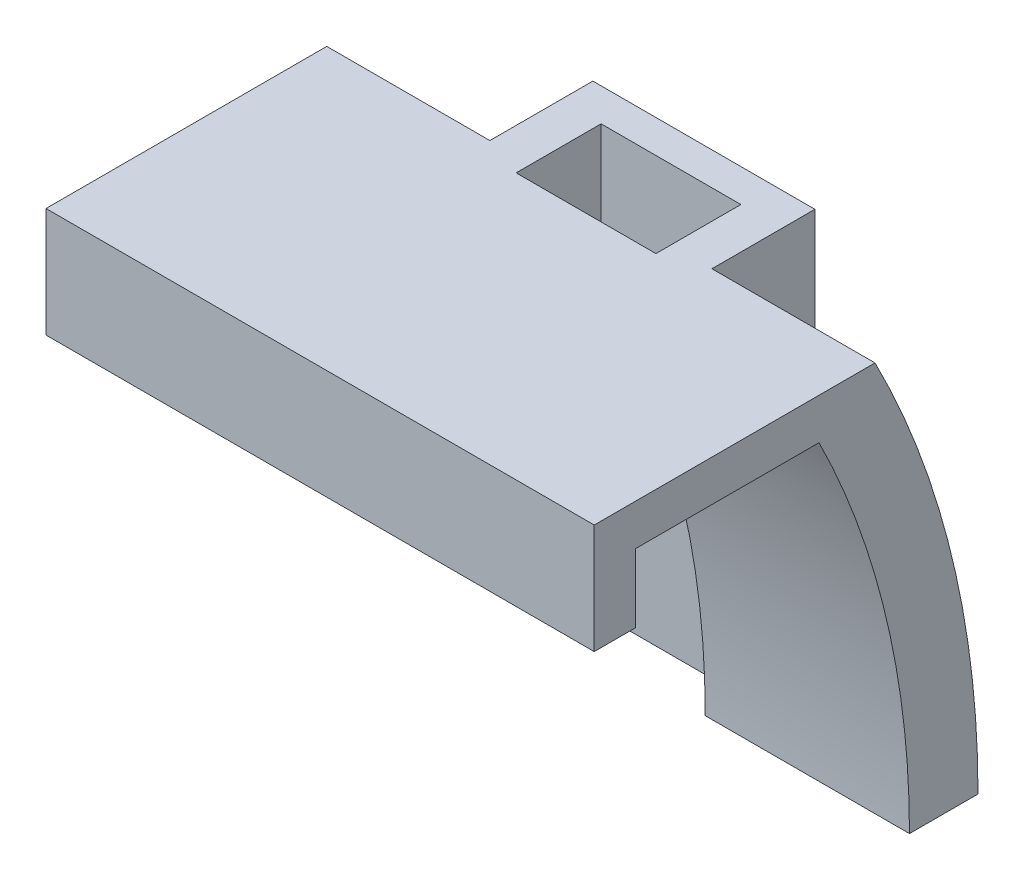
from build123d import *

# Parameters (mm, degrees)
BOSS_EXTRUDE1_DEPTH = 25.4
BOSS_EXTRUDE2_DEPTH = 10.287
SKETCH4_W           = 12.954
SKETCH4_H           = 7.874
CUT_EXTRUDE1_DEPTH  = 57.596991086


with BuildPart() as part:
    # Sketch2 → Boss-Extrude1 (new, symmetric)
    with BuildSketch(Plane(origin=(0, 0, 0), x_dir=(0, 0, -1), z_dir=(1, 0, 0))):
        with BuildLine():
            Line((0, 0), (0, -6.35))
            Line((0, -6.35), (-3.81, -6.35))
            Line((-3.81, -6.35), (-3.81, 3.81))
            Line((-3.81, 3.81), (22.20557735, 3.81))
            ThreePointArc((22.20557735, 3.81), (29.329829331, -15.304797559), (31.75, -35.56))
            Line((31.75, -35.56), (25.4, -35.56))
            ThreePointArc((25.4, -35.56), (23.276174446, -17.292737452), (17.018, 0))
            Line((17.018, 0), (0, 0))
        make_face()
    extrude(amount=BOSS_EXTRUDE1_DEPTH, both=True)

    # Sketch3 → Boss-Extrude2 (add, symmetric)
    with BuildSketch(Plane(origin=(0, 0, 0), x_dir=(0, 0, -1), z_dir=(1, 0, 0))):
        Polygon((31.75, -35.56), (31.75, 3.81), (22.20557735, 3.81), align=None)
    extrude(amount=BOSS_EXTRUDE2_DEPTH, both=True)

    # Sketch4 → Cut-Extrude1 (cut, through all)
    with BuildSketch(Plane(origin=(0, 3.81, 0), x_dir=(1, 0, 0), z_dir=(0, 1, 0))):
        with Locations((0, 24.765)):
            Rectangle(SKETCH4_W, SKETCH4_H)
    extrude(amount=-CUT_EXTRUDE1_DEPTH, mode=Mode.SUBTRACT)


solid = part.part
